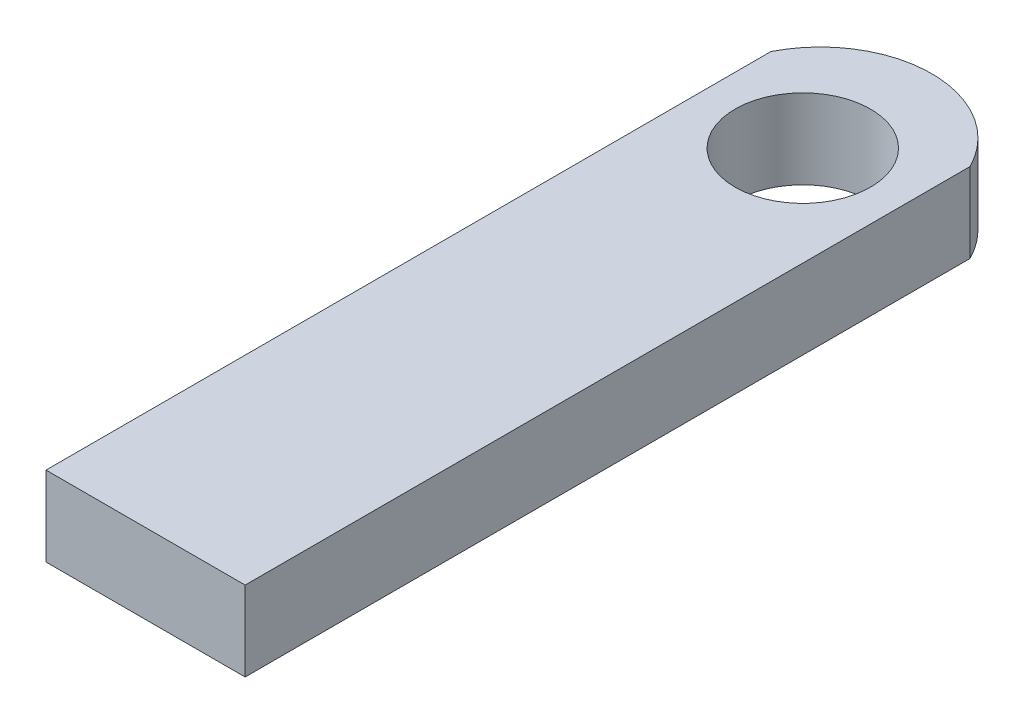
from build123d import *

# Parameters (mm, degrees)
SKETCH1_R           = 1.7
BOSS_EXTRUDE1_DEPTH = 2


with BuildPart() as part:
    # Sketch1 → Boss-Extrude1 (new body)
    with BuildSketch(Plane(origin=(0, 0, 0), x_dir=(1, 0, 0), z_dir=(0, 1, 0))):
        with BuildLine():
            Line((0, 0), (-5, 0))
            Line((-5, 0), (-5, 18.2))
            ThreePointArc((-5, 18.2), (-2.5, 19.739047979), (0, 18.2))
            Line((0, 18.2), (0, 0))
        make_face()
        with Locations((-2.5, 16.5)):
            Circle(SKETCH1_R, mode=Mode.SUBTRACT)
    extrude(amount=BOSS_EXTRUDE1_DEPTH)


solid = part.part
